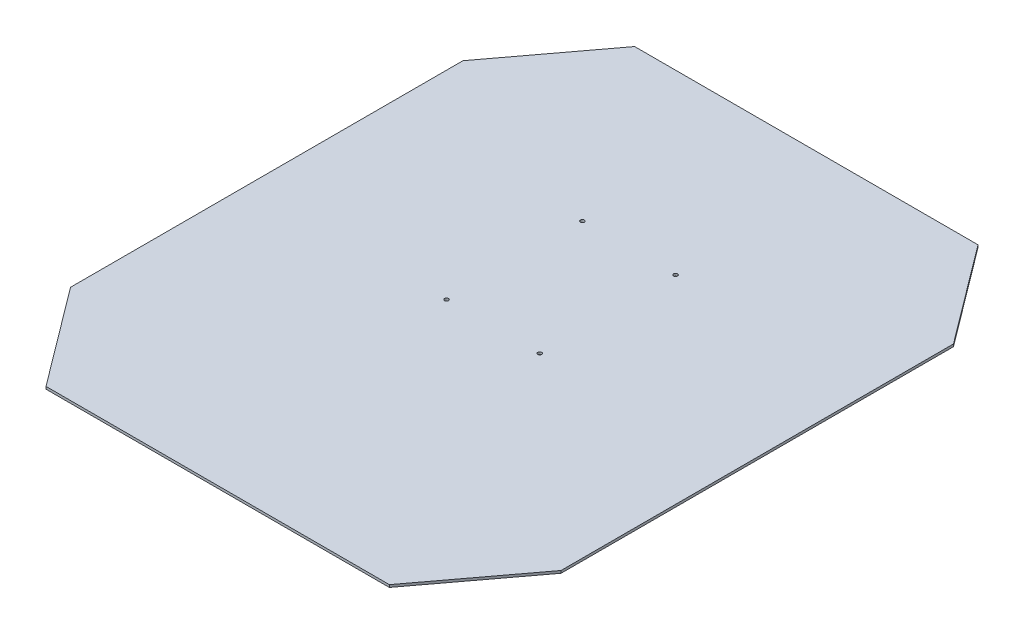
from build123d import *

# Parameters (mm, degrees)
BOSS_EXTRUDE1_DEPTH = 5
SKETCH2_R           = 4
CUT_EXTRUDE1_DEPTH  = 782.040972037


with BuildPart() as part:
    # Sketch1 → Boss-Extrude1 (new body)
    with BuildSketch(Plane(origin=(0, 0, 0), x_dir=(1, 0, 0), z_dir=(0, 1, 0))):
        Polygon((-350, 600), (-500, 400), (-500, -400), (-350, -600), (350, -600), (500, -400), (500, 400), (350, 600), align=None)
    extrude(amount=BOSS_EXTRUDE1_DEPTH)

    # Sketch2 → Cut-Extrude1 (cut, through all)
    with BuildSketch(Plane(origin=(0, 5, 0), x_dir=(1, 0, 0), z_dir=(0, 1, 0))):
        with Locations((95, 238.5)):
            Circle(SKETCH2_R)
        with Locations((-95, 238.5)):
            Circle(SKETCH2_R)
        with Locations((95, -38.5)):
            Circle(SKETCH2_R)
        with Locations((-95, -38.5)):
            Circle(SKETCH2_R)
    extrude(amount=-CUT_EXTRUDE1_DEPTH, mode=Mode.SUBTRACT)


solid = part.part
